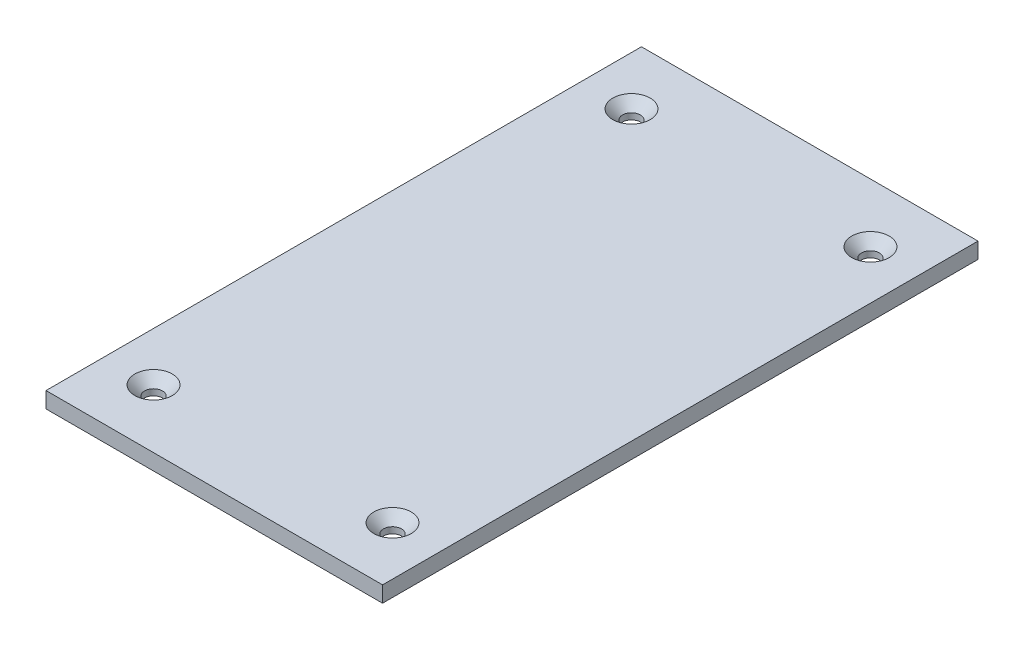
from build123d import *

# Parameters (mm, degrees)
SKETCH1_W                                      = 84.5
SKETCH1_H                                      = 149.5
BASE_FLANGE1_DEPTH                             = 4
CSK_FOR_M4_FLAT_HEAD_MACHINE_SCREW1_AT_2_COUNT = 2
CSK_FOR_M4_FLAT_HEAD_MACHINE_SCREW1_AT_2_PITCH = 60
CSK_FOR_M4_FLAT_HEAD_MACHINE_SCREW1_AT_3_COUNT = 2
CSK_FOR_M4_FLAT_HEAD_MACHINE_SCREW1_AT_3_PITCH = 134.16407865
CSK_FOR_M4_FLAT_HEAD_MACHINE_SCREW1_AT_4_COUNT = 2
CSK_FOR_M4_FLAT_HEAD_MACHINE_SCREW1_AT_4_PITCH = 120


# Sheet-metal steps are written as plain solids
with BuildPart() as part:
    # Sketch1 → Base-Flange1 (new body)
    with BuildSketch(Plane(origin=(0, 0, 0), x_dir=(1, 0, 0), z_dir=(0, 1, 0))):
        Rectangle(SKETCH1_W, SKETCH1_H)
    extrude(amount=-BASE_FLANGE1_DEPTH)

    # Sketch5 → CSK for M4 Flat Head Machine Screw1 (revolve, cut)
    with BuildSketch(Plane(origin=(30, 0, -60), x_dir=(0, 0, 1), z_dir=(1, 0, 0))):
        Polygon((0, 0), (0, 4), (2.25, 4), (2.25, 2.45), (4.7, 0), align=None)
    csk_for_m4_flat_head_machine_screw1 = revolve(axis=Axis((30, 6.35, -60), (0, -1, 0)), mode=Mode.SUBTRACT)

    # CSK for M4 Flat Head Machine Screw1 at 2: CSK for M4 Flat Head Machine Screw1 ×2
    with Locations(*[(-i * CSK_FOR_M4_FLAT_HEAD_MACHINE_SCREW1_AT_2_PITCH, 0, 0) for i in range(1, CSK_FOR_M4_FLAT_HEAD_MACHINE_SCREW1_AT_2_COUNT)]):
        add(csk_for_m4_flat_head_machine_screw1, mode=Mode.SUBTRACT)

    # CSK for M4 Flat Head Machine Screw1 at 3: CSK for M4 Flat Head Machine Screw1 ×2
    with Locations(*[Vector(-0.44721359549995787, 0, 0.894427190999916) * (i * CSK_FOR_M4_FLAT_HEAD_MACHINE_SCREW1_AT_3_PITCH) for i in range(1, CSK_FOR_M4_FLAT_HEAD_MACHINE_SCREW1_AT_3_COUNT)]):
        add(csk_for_m4_flat_head_machine_screw1, mode=Mode.SUBTRACT)

    # CSK for M4 Flat Head Machine Screw1 at 4: CSK for M4 Flat Head Machine Screw1 ×2
    with Locations(*[(0, 0, i * CSK_FOR_M4_FLAT_HEAD_MACHINE_SCREW1_AT_4_PITCH) for i in range(1, CSK_FOR_M4_FLAT_HEAD_MACHINE_SCREW1_AT_4_COUNT)]):
        add(csk_for_m4_flat_head_machine_screw1, mode=Mode.SUBTRACT)


solid = part.part
